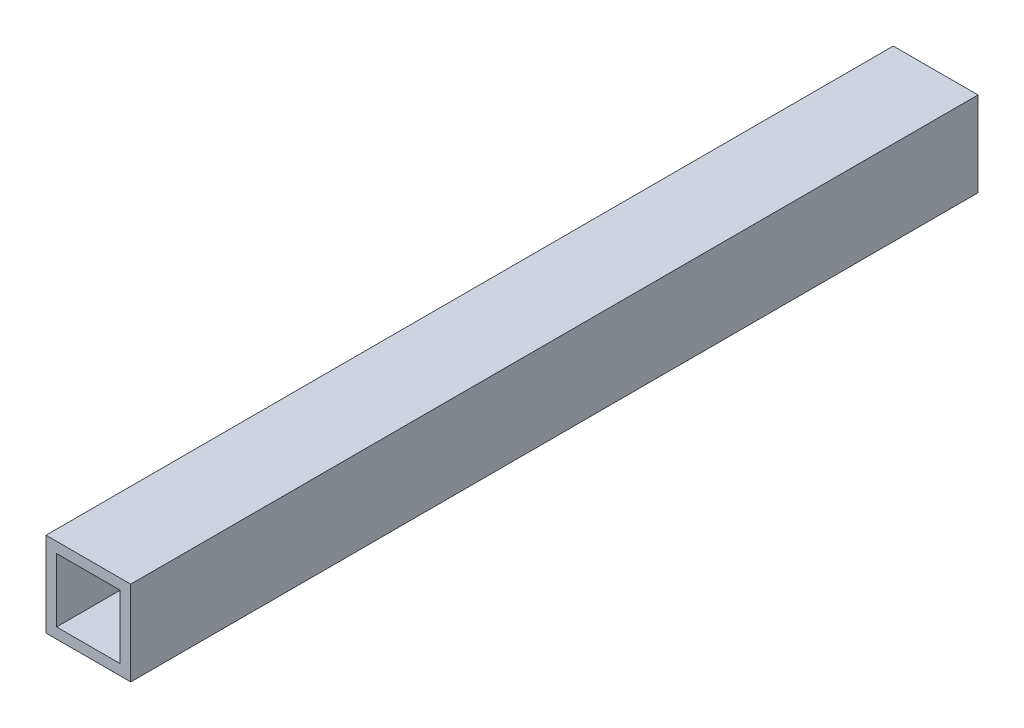
from build123d import *

# Parameters (mm, degrees)
SKETCH1_W           = 25.4
SKETCH1_H           = 25.4
BOSS_EXTRUDE1_DEPTH = 127
SHELL1_T            = -3.175


with BuildPart() as part:
    # Sketch1 → Boss-Extrude1 (new, symmetric)
    with BuildSketch(Plane.XY):
        Rectangle(SKETCH1_W, SKETCH1_H)
    extrude(amount=BOSS_EXTRUDE1_DEPTH, both=True)

    # Shell1
    shell1_openings = [part.faces().sort_by_distance(p)[0] for p in [
        (0, 0, -127),
        (0, 0, 127),
    ]]
    offset(amount=SHELL1_T, openings=shell1_openings, kind=Kind.INTERSECTION)


solid = part.part
